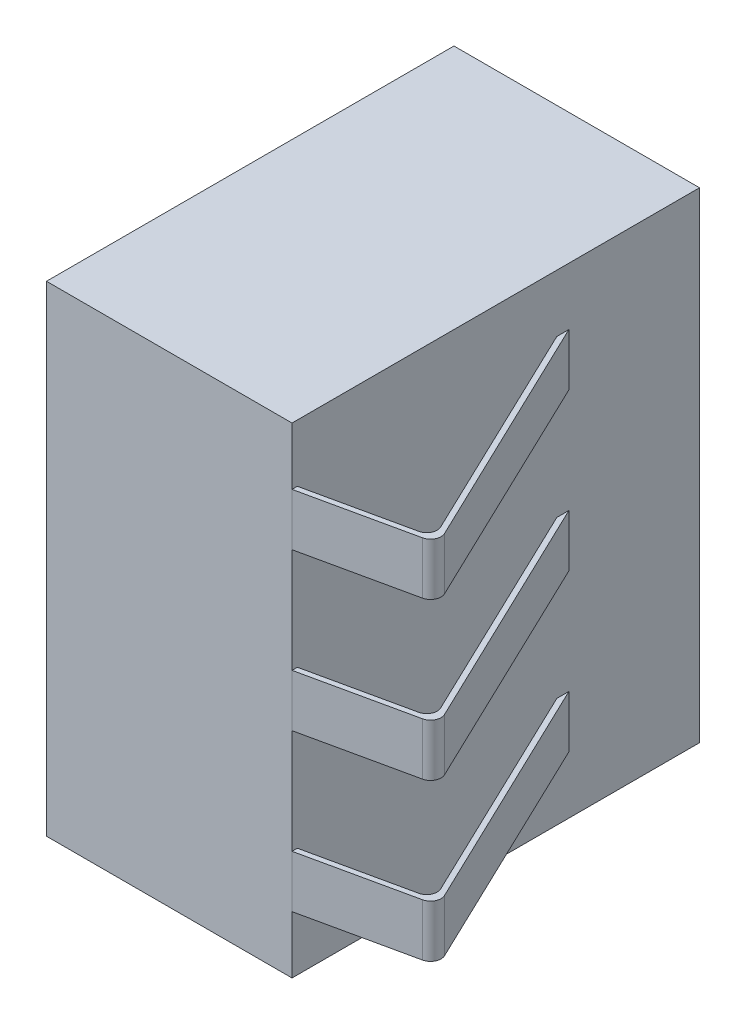
from build123d import *

# Parameters (mm, degrees)
SKETCH1_W                  = 4.7
SKETCH1_H                  = 9.2
BOSS_EXTRUDE1_DEPTH        = 7.8
BOSS_EXTRUDE2_DEPTH        = 0.5
FILLET1_R                  = 0.2
FILLET2_R                  = 0.2
LPATTERN2_COUNT            = 2
LPATTERN2_PITCH            = 3
FILLET1_OF_LPATTERN2_R     = 0.2
FILLET2_OF_LPATTERN2_R     = 0.2
LPATTERN2_COL_COUNT        = 2
LPATTERN2_COL_PITCH        = 3
FILLET1_OF_LPATTERN2_COL_R = 0.2
FILLET2_OF_LPATTERN2_COL_R = 0.2


with BuildPart() as part:
    # Sketch1 → Boss-Extrude1 (new body)
    with BuildSketch(Plane.XY):
        Rectangle(SKETCH1_W, SKETCH1_H)
    extrude(amount=BOSS_EXTRUDE1_DEPTH)

    # Sketch2 → Boss-Extrude2 (add, symmetric)
    with BuildSketch(Plane(origin=(0, 0, 0), x_dir=(1, 0, 0), z_dir=(0, 1, 0))):
        Polygon((2.35, -7.8), (4.65, -7.3), (2.35, -2.5), (2.35, -2.731417102), (4.50516389, -7.229150439), (2.35, -7.697664328), align=None)
    boss_extrude2 = extrude(amount=BOSS_EXTRUDE2_DEPTH, both=True)

    # Fillet1
    fillet1_edges = [part.edges().sort_by_distance(p)[0] for p in [
        (4.50516389, 0, 7.229150439),
    ]]
    fillet(fillet1_edges, radius=FILLET1_R)

    # Fillet2
    fillet2_edges = [part.edges().sort_by_distance(p)[0] for p in [
        (4.65, 0, 7.3),
    ]]
    fillet(fillet2_edges, radius=FILLET2_R)

    # LPattern2: Boss-Extrude2 ×2
    with Locations(*[(0, -i * LPATTERN2_PITCH, 0) for i in range(1, LPATTERN2_COUNT)]):
        add(boss_extrude2)

    # Fillet1 of LPattern2
    fillet1_of_lpattern2_edges = [part.edges().sort_by_distance(p)[0] for p in [
        (4.50516389, -3, 7.229150439),
    ]]
    fillet(fillet1_of_lpattern2_edges, radius=FILLET1_OF_LPATTERN2_R)

    # Fillet2 of LPattern2
    fillet2_of_lpattern2_edges = [part.edges().sort_by_distance(p)[0] for p in [
        (4.65, -3, 7.3),
    ]]
    fillet(fillet2_of_lpattern2_edges, radius=FILLET2_OF_LPATTERN2_R)

    # LPattern2 col: Boss-Extrude2 ×2
    with Locations(*[(0, i * LPATTERN2_COL_PITCH, 0) for i in range(1, LPATTERN2_COL_COUNT)]):
        add(boss_extrude2)

    # Fillet1 of LPattern2 col
    fillet1_of_lpattern2_col_edges = [part.edges().sort_by_distance(p)[0] for p in [
        (4.50516389, 3, 7.229150439),
    ]]
    fillet(fillet1_of_lpattern2_col_edges, radius=FILLET1_OF_LPATTERN2_COL_R)

    # Fillet2 of LPattern2 col
    fillet2_of_lpattern2_col_edges = [part.edges().sort_by_distance(p)[0] for p in [
        (4.65, 3, 7.3),
    ]]
    fillet(fillet2_of_lpattern2_col_edges, radius=FILLET2_OF_LPATTERN2_COL_R)


solid = part.part
